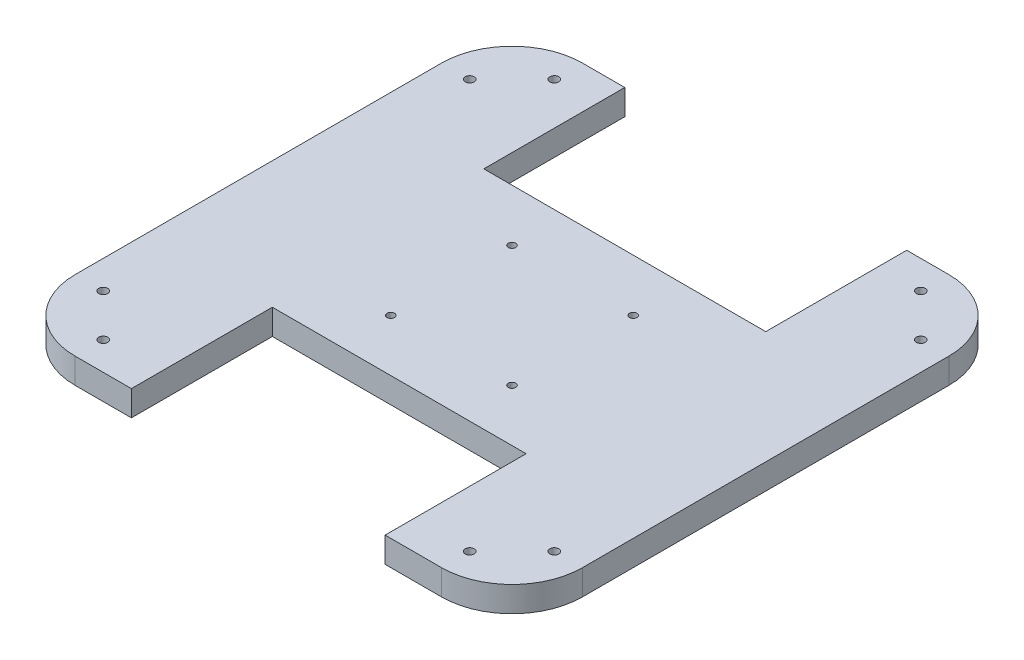
from build123d import *

# Parameters (mm, degrees)
PLATE_DEPTH        = 9
SKETCH3_R          = 1.6
HEX_HOLES_DEPTH    = 128.597021909
SKETCH4_R          = 1.325
LIDAR_HOLES_DEPTH  = 128.597021909
SKETCH5_W          = 100
SKETCH5_H          = 50
SKETCH5_W_2        = 90
CUT_EXTRUDE1_DEPTH = 128.597021909


with BuildPart() as part:
    # Sketch1 → Plate (new body)
    with BuildSketch(Plane(origin=(0, 0, 0), x_dir=(1, 0, 0), z_dir=(0, 1, 0))):
        with BuildLine():
            Line((-65, -90), (65, -90))
            ThreePointArc((65, -90), (82.67766953, -82.67766953), (90, -65))
            Line((90, -65), (90, 65))
            ThreePointArc((90, 65), (82.67766953, 82.67766953), (65, 90))
            Line((65, 90), (-65, 90))
            ThreePointArc((-65, 90), (-82.67766953, 82.67766953), (-90, 65))
            Line((-90, 65), (-90, -65))
            ThreePointArc((-90, -65), (-82.67766953, -82.67766953), (-65, -90))
        make_face()
    extrude(amount=PLATE_DEPTH)

    # Sketch3 → Hex Holes (cut, through all)
    with BuildSketch(Plane(origin=(0, 9, 0), x_dir=(1, 0, 0), z_dir=(0, 1, 0))):
        with Locations((-65, 80)):
            Circle(SKETCH3_R)
        with Locations((-80, 65)):
            Circle(SKETCH3_R)
        with Locations((80, 65)):
            Circle(SKETCH3_R)
        with Locations((80, -65)):
            Circle(SKETCH3_R)
        with Locations((65, 80)):
            Circle(SKETCH3_R)
        with Locations((65, -80)):
            Circle(SKETCH3_R)
        with Locations((-65, -80)):
            Circle(SKETCH3_R)
        with Locations((-80, -65)):
            Circle(SKETCH3_R)
    extrude(amount=-HEX_HOLES_DEPTH, mode=Mode.SUBTRACT)

    # Sketch4 → LiDAR Holes (cut, through all)
    with BuildSketch(Plane(origin=(0, 9, 0), x_dir=(1, 0, 0), z_dir=(0, 1, 0))):
        with Locations((-21.5, 21.5)):
            Circle(SKETCH4_R)
        with Locations((21.5, 21.5)):
            Circle(SKETCH4_R)
        with Locations((21.5, -21.5)):
            Circle(SKETCH4_R)
        with Locations((-21.5, -21.5)):
            Circle(SKETCH4_R)
    extrude(amount=-LIDAR_HOLES_DEPTH, mode=Mode.SUBTRACT)

    # Sketch5 → Cut-Extrude1 (cut, through all)
    with BuildSketch(Plane(origin=(0, 9, 0), x_dir=(1, 0, 0), z_dir=(0, 1, 0))):
        with Locations((0, 65)):
            Rectangle(SKETCH5_W, SKETCH5_H)
        with Locations((0, -65)):
            Rectangle(SKETCH5_W_2, SKETCH5_H)
    extrude(amount=-CUT_EXTRUDE1_DEPTH, mode=Mode.SUBTRACT)


solid = part.part
